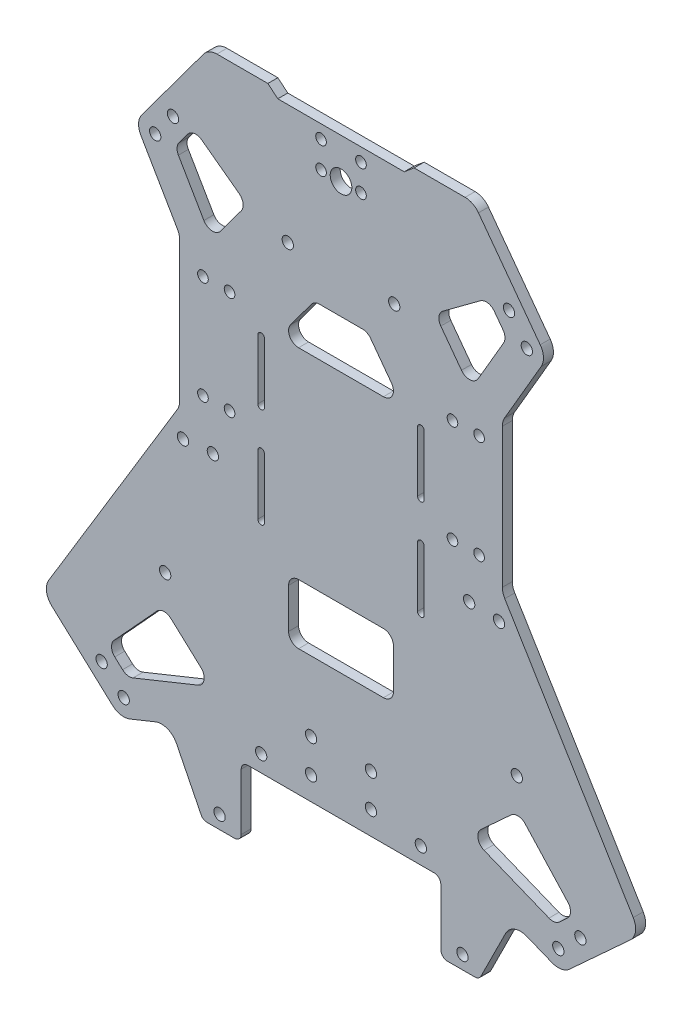
from build123d import *

# Parameters (mm, degrees)
BOSS_EXTRUDE1_DEPTH          = 3
SKETCH1_3_R                  = 1.6
CUT_EXTRUDE1_DEPTH           = 219.410327582
FILLET1_R                    = 5
FILLET2_R                    = 2
M3_CLEARANCE_HOLE2_D         = 3.4
M3_CLEARANCE_HOLE3_D         = 3.4
FILLET1_OF_MIRROR2_R         = 5
FILLET2_OF_MIRROR2_R         = 2
F_2_0_2_DIAMETER_SLOT1_DEPTH = 3
CUT_EXTRUDE2_REACH           = 219.837
SKETCH12_R                   = 3.25
SKETCH12_R_2                 = 1.6


# Read off the part's stored shape, not the designer's step: Ø2.0 (2) Diameter Slot1
with BuildPart() as part:
    # Sketch1 → Boss-Extrude1 (new body)
    with BuildSketch(Plane.XY):
        Polygon((0, 0), (19, 0), (21.979383981, 2.5), (39.821592002, 2.5), (61.830035112, -27.242703843), (48.5, -50.145982296), (48.5, -94.813552722), (89.961498401, -163.230978502), (66.372111015, -184.85367035), (51.536202762, -178.862357781), (41.5, -199), (30, -199), (30, -178), (0, -178), align=None)
    boss_extrude1 = extrude(amount=BOSS_EXTRUDE1_DEPTH)

    # Sketch1<3> → Cut-Extrude1 (cut, through all)
    with BuildSketch(Plane.XY):
        with Locations((6, -4)):
            Circle(SKETCH1_3_R)
        with Locations((41.5, -57.5)):
            Circle(SKETCH1_3_R)
        with Locations((33.5, -57.5)):
            Circle(SKETCH1_3_R)
        with Locations((41.5, -88.5)):
            Circle(SKETCH1_3_R)
        with Locations((33.5, -88.5)):
            Circle(SKETCH1_3_R)
    cut_extrude1 = extrude(amount=CUT_EXTRUDE1_DEPTH, mode=Mode.SUBTRACT)

    # Fillet1
    fillet1_edges = [part.edges().sort_by_distance(p)[0] for p in [
        (51.536202762, -178.862357781, 1.5),
        (66.372111015, -184.85367035, 1.5),
        (89.961498401, -163.230978502, 1.5),
        (48.5, -94.813552722, 1.5),
        (48.5, -50.145982296, 1.5),
        (61.830035112, -27.242703843, 1.5),
        (39.821592002, 2.5, 1.5),
    ]]
    fillet(fillet1_edges, radius=FILLET1_R)

    # Fillet2
    fillet2_edges = [part.edges().sort_by_distance(p)[0] for p in [
        (30, -178, 1.5),
        (30, -199, 1.5),
        (41.5, -199, 1.5),
    ]]
    fillet(fillet2_edges, radius=FILLET2_R)

    # M3 Clearance Hole2 (through all)
    with Locations(Plane.XY.offset(3)):
        with Locations((65.319158384, -179.03612505), (71.953673586, -172.954742967), (52.849782983, -140.273840841), (47.493235343, -102.79975116), (38.515884824, -102.16164642), (55.853405081, -27.571616841), (50.5, -20.336905095), (15.998713863, -35.91449332)):
            m3_clearance_hole2 = Hole(M3_CLEARANCE_HOLE2_D / 2)

    # M3 Clearance Hole3 (through all)
    with Locations(Plane.XY.offset(3)):
        with Locations((9, -171), (24, -173), (9, -161), (36.5, -195)):
            m3_clearance_hole3 = Hole(M3_CLEARANCE_HOLE3_D / 2)

    # Mirror2: Boss-Extrude1, Cut-Extrude1, M3 Clearance Hole2, M3 Clearance Hole3 across plane
    add(boss_extrude1.mirror(Plane(origin=(0, 0, 3), x_dir=(0, 0, 1), z_dir=(1, 0, 0))))
    add(cut_extrude1.mirror(Plane(origin=(0, 0, 3), x_dir=(0, 0, 1), z_dir=(1, 0, 0))), mode=Mode.SUBTRACT)
    add(m3_clearance_hole2.mirror(Plane(origin=(0, 0, 3), x_dir=(0, 0, 1), z_dir=(1, 0, 0))), mode=Mode.SUBTRACT)
    add(m3_clearance_hole3.mirror(Plane(origin=(0, 0, 3), x_dir=(0, 0, 1), z_dir=(1, 0, 0))), mode=Mode.SUBTRACT)

    # Fillet1 of Mirror2
    fillet1_of_mirror2_edges = [part.edges().sort_by_distance(p)[0] for p in [
        (-51.536202762, -178.862357781, 1.5),
        (-66.372111015, -184.85367035, 1.5),
        (-89.961498401, -163.230978502, 1.5),
        (-48.5, -94.813552722, 1.5),
        (-48.5, -50.145982296, 1.5),
        (-61.830035112, -27.242703843, 1.5),
        (-39.821592002, 2.5, 1.5),
    ]]
    fillet(fillet1_of_mirror2_edges, radius=FILLET1_OF_MIRROR2_R)

    # Fillet2 of Mirror2
    fillet2_of_mirror2_edges = [part.edges().sort_by_distance(p)[0] for p in [
        (-30, -178, 1.5),
        (-30, -199, 1.5),
        (-41.5, -199, 1.5),
    ]]
    fillet(fillet2_of_mirror2_edges, radius=FILLET2_OF_MIRROR2_R)

    # Ø2.0 (2) Diameter Slot1 outline → Ø2.0 (2) Diameter Slot1 (cut)
    with BuildSketch(Plane.XY):
        with BuildLine():
            Line((-23, -82.416765984), (-23, -64.416765984))
            ThreePointArc((-23, -64.416765984), (-24, -63.416765984), (-25, -64.416765984))
            Line((-25, -64.416765984), (-25, -82.416765984))
            ThreePointArc((-25, -82.416765984), (-24, -83.416765984), (-23, -82.416765984))
        make_face()
        with BuildLine():
            ThreePointArc((-23, -94.416765984), (-24, -93.416765984), (-25, -94.416765984))
            Line((-25, -94.416765984), (-25, -112.416765984))
            ThreePointArc((-25, -112.416765984), (-24, -113.416765984), (-23, -112.416765984))
            Line((-23, -112.416765984), (-23, -94.416765984))
        make_face()
        with BuildLine():
            Line((25, -82.416765984), (25, -64.416765984))
            ThreePointArc((25, -64.416765984), (24, -63.416765984), (23, -64.416765984))
            Line((23, -64.416765984), (23, -82.416765984))
            ThreePointArc((23, -82.416765984), (24, -83.416765984), (25, -82.416765984))
        make_face()
        with BuildLine():
            ThreePointArc((25, -94.416765984), (24, -93.416765984), (23, -94.416765984))
            Line((23, -94.416765984), (23, -112.416765984))
            ThreePointArc((23, -112.416765984), (24, -113.416765984), (25, -112.416765984))
            Line((25, -112.416765984), (25, -94.416765984))
        make_face()
    extrude(amount=F_2_0_2_DIAMETER_SLOT1_DEPTH, mode=Mode.SUBTRACT)

    # Sketch12 → Cut-Extrude2 (cut, up to next)
    with BuildSketch(Plane.XY.offset(3), mode=Mode.PRIVATE) as cut_extrude2_sk1:
        with Locations((0, -12)):
            Circle(SKETCH12_R)
    cut_extrude2_tool1 = extrude(cut_extrude2_sk1.sketch, amount=-CUT_EXTRUDE2_REACH, mode=Mode.PRIVATE) & part.part
    # Sketch12 → Cut-Extrude2 (cut, up to next)
    with BuildSketch(Plane.XY.offset(3), mode=Mode.PRIVATE) as cut_extrude2_sk2:
        with Locations((6, -12)):
            Circle(SKETCH12_R_2)
    cut_extrude2_tool2 = extrude(cut_extrude2_sk2.sketch, amount=-CUT_EXTRUDE2_REACH, mode=Mode.PRIVATE) & part.part
    # Sketch12 → Cut-Extrude2 (cut, up to next)
    with BuildSketch(Plane.XY.offset(3), mode=Mode.PRIVATE) as cut_extrude2_sk3:
        with Locations((-6, -12)):
            Circle(SKETCH12_R_2)
    cut_extrude2_tool3 = extrude(cut_extrude2_sk3.sketch, amount=-CUT_EXTRUDE2_REACH, mode=Mode.PRIVATE) & part.part
    # Sketch12 → Cut-Extrude2 (cut, up to next)
    with BuildSketch(Plane.XY.offset(3), mode=Mode.PRIVATE) as cut_extrude2_sk4:
        with BuildLine():
            Line((-41.881813558, -22.139478444), (-30.627817509, -30.466997458))
            ThreePointArc((-30.627817509, -30.466997458), (-29.445238279, -32.435139807), (-30.000715288, -34.6630364))
            Line((-30.000715288, -34.6630364), (-36.211623877, -43.056597628))
            ThreePointArc((-36.211623877, -43.056597628), (-38.788044571, -44.267596583), (-41.216018434, -42.781189846))
            Line((-41.216018434, -42.781189846), (-48.883621007, -29.606938217))
            ThreePointArc((-48.883621007, -29.606938217), (-49.286264347, -27.933027525), (-48.702367613, -26.313409278))
            Line((-48.702367613, -26.313409278), (-46.0778525, -22.766580665))
            ThreePointArc((-46.0778525, -22.766580665), (-44.109710151, -21.584001436), (-41.881813558, -22.139478444))
        make_face()
    cut_extrude2_tool4 = extrude(cut_extrude2_sk4.sketch, amount=-CUT_EXTRUDE2_REACH, mode=Mode.PRIVATE) & part.part
    # Sketch12 → Cut-Extrude2 (cut, up to next)
    with BuildSketch(Plane.XY.offset(3), mode=Mode.PRIVATE) as cut_extrude2_sk5:
        with BuildLine():
            Line((41.216018434, -42.781189846), (48.883621007, -29.606938217))
            ThreePointArc((48.883621007, -29.606938217), (49.286264347, -27.933027525), (48.702367613, -26.313409278))
            Line((48.702367613, -26.313409278), (46.0778525, -22.766580665))
            ThreePointArc((46.0778525, -22.766580665), (44.109710151, -21.584001436), (41.881813558, -22.139478444))
            Line((41.881813558, -22.139478444), (30.627817509, -30.466997458))
            ThreePointArc((30.627817509, -30.466997458), (29.445238279, -32.435139807), (30.000715288, -34.6630364))
            Line((30.000715288, -34.6630364), (36.211623877, -43.056597628))
            ThreePointArc((36.211623877, -43.056597628), (38.788044571, -44.267596583), (41.216018434, -42.781189846))
        make_face()
    cut_extrude2_tool5 = extrude(cut_extrude2_sk5.sketch, amount=-CUT_EXTRUDE2_REACH, mode=Mode.PRIVATE) & part.part
    # Sketch12 → Cut-Extrude2 (cut, up to next)
    with BuildSketch(Plane.XY.offset(3), mode=Mode.PRIVATE) as cut_extrude2_sk6:
        with BuildLine():
            Line((65.661561535, -171.939557637), (68.007786071, -169.788942645))
            ThreePointArc((68.007786071, -169.788942645), (68.977824443, -167.707812304), (68.192163778, -165.550310217))
            Line((68.192163778, -165.550310217), (55.353690493, -151.544111456))
            ThreePointArc((55.353690493, -151.544111456), (53.272560152, -150.574073084), (51.115058065, -151.35973375))
            Line((51.115058065, -151.35973375), (42.088219413, -159.633986376))
            ThreePointArc((42.088219413, -159.633986376), (41.163310825, -162.379798245), (42.991975667, -164.627224241))
            Line((42.991975667, -164.627224241), (62.511063067, -172.509785367))
            ThreePointArc((62.511063067, -172.509785367), (64.168740975, -172.680088518), (65.661561535, -171.939557637))
        make_face()
    cut_extrude2_tool6 = extrude(cut_extrude2_sk6.sketch, amount=-CUT_EXTRUDE2_REACH, mode=Mode.PRIVATE) & part.part
    # Sketch12 → Cut-Extrude2 (cut, up to next)
    with BuildSketch(Plane.XY.offset(3), mode=Mode.PRIVATE) as cut_extrude2_sk7:
        with BuildLine():
            Line((-51.115058065, -151.35973375), (-42.088219413, -159.633986376))
            ThreePointArc((-42.088219413, -159.633986376), (-41.163310825, -162.379798245), (-42.991975667, -164.627224241))
            Line((-42.991975667, -164.627224241), (-62.511063067, -172.509785367))
            ThreePointArc((-62.511063067, -172.509785367), (-64.168740975, -172.680088518), (-65.661561535, -171.939557637))
            Line((-65.661561535, -171.939557637), (-68.007786071, -169.788942645))
            ThreePointArc((-68.007786071, -169.788942645), (-68.977824443, -167.707812304), (-68.192163778, -165.550310217))
            Line((-68.192163778, -165.550310217), (-55.353690493, -151.544111456))
            ThreePointArc((-55.353690493, -151.544111456), (-53.272560152, -150.574073084), (-51.115058065, -151.35973375))
        make_face()
    cut_extrude2_tool7 = extrude(cut_extrude2_sk7.sketch, amount=-CUT_EXTRUDE2_REACH, mode=Mode.PRIVATE) & part.part
    # Sketch12 → Cut-Extrude2 (cut, up to next)
    with BuildSketch(Plane.XY.offset(3), mode=Mode.PRIVATE) as cut_extrude2_sk8:
        with BuildLine():
            Line((6.487875517, -47.210701628), (-6.487875517, -47.210701628))
            ThreePointArc((-6.487875517, -47.210701628), (-7.83817084, -47.531764798), (-8.899446099, -48.426233268))
            Line((-8.899446099, -48.426233268), (-15.16648981, -56.895656759))
            ThreePointArc((-15.16648981, -56.895656759), (-15.433856059, -60.030420442), (-12.754919228, -61.680125119))
            Line((-12.754919228, -61.680125119), (12.754919228, -61.680125119))
            ThreePointArc((12.754919228, -61.680125119), (15.433856059, -60.030420442), (15.16648981, -56.895656759))
            Line((15.16648981, -56.895656759), (8.899446099, -48.426233268))
            ThreePointArc((8.899446099, -48.426233268), (7.83817084, -47.531764798), (6.487875517, -47.210701628))
        make_face()
    cut_extrude2_tool8 = extrude(cut_extrude2_sk8.sketch, amount=-CUT_EXTRUDE2_REACH, mode=Mode.PRIVATE) & part.part
    # Sketch12 → Cut-Extrude2 (cut, up to next)
    with BuildSketch(Plane.XY.offset(3), mode=Mode.PRIVATE) as cut_extrude2_sk9:
        with BuildLine():
            Line((-12.754919228, -140.018512007), (12.754919228, -140.018512007))
            ThreePointArc((12.754919228, -140.018512007), (14.876239572, -139.13983235), (15.754919228, -137.018512007))
            Line((15.754919228, -137.018512007), (15.754919228, -125.018512007))
            ThreePointArc((15.754919228, -125.018512007), (14.876239572, -122.897191663), (12.754919228, -122.018512007))
            Line((12.754919228, -122.018512007), (-12.754919228, -122.018512007))
            ThreePointArc((-12.754919228, -122.018512007), (-14.876239572, -122.897191663), (-15.754919228, -125.018512007))
            Line((-15.754919228, -125.018512007), (-15.754919228, -137.018512007))
            ThreePointArc((-15.754919228, -137.018512007), (-14.876239572, -139.13983235), (-12.754919228, -140.018512007))
        make_face()
    cut_extrude2_tool9 = extrude(cut_extrude2_sk9.sketch, amount=-CUT_EXTRUDE2_REACH, mode=Mode.PRIVATE) & part.part
    add(cut_extrude2_tool1.solids().sort_by_distance((0, -12, 3))[0], mode=Mode.SUBTRACT)
    add(cut_extrude2_tool2.solids().sort_by_distance((6, -12, 3))[0], mode=Mode.SUBTRACT)
    add(cut_extrude2_tool3.solids().sort_by_distance((-6, -12, 3))[0], mode=Mode.SUBTRACT)
    add(cut_extrude2_tool4.solids().sort_by_distance((-39.651234, -32.486535, 3))[0], mode=Mode.SUBTRACT)
    add(cut_extrude2_tool5.solids().sort_by_distance((39.651234, -32.486535, 3))[0], mode=Mode.SUBTRACT)
    add(cut_extrude2_tool6.solids().sort_by_distance((55.227682, -162.285181, 3))[0], mode=Mode.SUBTRACT)
    add(cut_extrude2_tool7.solids().sort_by_distance((-55.227682, -162.285181, 3))[0], mode=Mode.SUBTRACT)
    add(cut_extrude2_tool8.solids().sort_by_distance((0, -55.209674, 3))[0], mode=Mode.SUBTRACT)
    add(cut_extrude2_tool9.solids().sort_by_distance((0, -131.018512, 3))[0], mode=Mode.SUBTRACT)


solid = part.part
